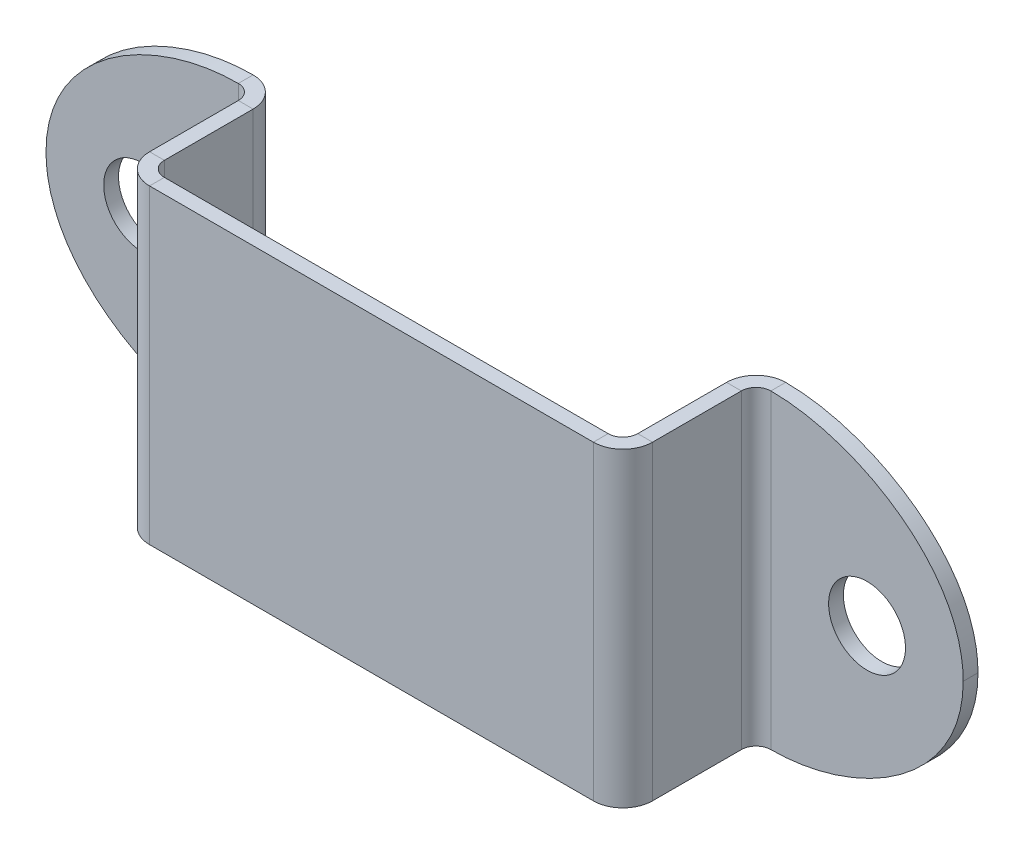
from build123d import *

# Parameters (mm, degrees)
BRIDA_BASE1_DEPTH     = 21
CROQUIS7_R            = 2.6
FORATS_CARGOLS_DEPTH  = 39.509739028
CORTAR_EXTRUIR1_DEPTH = 39.509739028


# Sheet-metal steps are written as plain solids
with BuildPart() as part:
    # Croquis1 → Brida base1 (new body)
    with BuildSketch(Plane(origin=(0, 0, 0), x_dir=(1, 0, 0), z_dir=(0, 1, 0))):
        with BuildLine():
            Line((-31, 0), (-18, 0))
            ThreePointArc((-18, 0), (-16.585786438, -0.585786438), (-16, -2))
            Line((-16, -2), (-16, -8))
            ThreePointArc((-16, -8), (-15.707106781, -8.707106781), (-15, -9))
            Line((-15, -9), (15, -9))
            ThreePointArc((15, -9), (15.707106781, -8.707106781), (16, -8))
            Line((16, -8), (16, -2))
            ThreePointArc((16, -2), (16.585786438, -0.585786438), (18, 0))
            Line((18, 0), (31, 0))
            Line((31, 0), (31, -1))
            Line((31, -1), (18, -1))
            ThreePointArc((18, -1), (17.292893219, -1.292893219), (17, -2))
            Line((17, -2), (17, -8))
            ThreePointArc((17, -8), (16.414213562, -9.414213562), (15, -10))
            Line((15, -10), (-15, -10))
            ThreePointArc((-15, -10), (-16.414213562, -9.414213562), (-17, -8))
            Line((-17, -8), (-17, -2))
            ThreePointArc((-17, -2), (-17.292893219, -1.292893219), (-18, -1))
            Line((-18, -1), (-31, -1))
            Line((-31, -1), (-31, 0))
        make_face()
    extrude(amount=BRIDA_BASE1_DEPTH)

    # Croquis7 → Forats cargols (cut, through all)
    with BuildSketch(Plane.XY.offset(1)):
        with Locations((-24.5, 10.5)):
            Circle(CROQUIS7_R)
        with Locations(Location((24.5, 10.5, 0), (0, 0, 180))):
            Circle(CROQUIS7_R)
    extrude(amount=-FORATS_CARGOLS_DEPTH, mode=Mode.SUBTRACT)

    # Croquis8 → Cortar-Extruir1 (cut, through all)
    with BuildSketch(Plane.XY.offset(1)):
        with BuildLine():
            Line((-18, 21), (-32, 21))
            Line((-32, 21), (-32, 0))
            Line((-32, 0), (-18, 0))
            add(Edge.make_bspline(
                [(-18, 0), (-23.840607907, 0), (-31, 4.168476811), (-31, 10.5)],
                knots=[0, 0, 0, 0, 1, 1, 1, 1], degree=3))
            add(Edge.make_bspline(
                [(-18, 21), (-23.840607907, 21), (-31, 16.831523189), (-31, 10.5)],
                knots=[0, 0, 0, 0, 1, 1, 1, 1], degree=3))
        make_face()
        with BuildLine():
            Line((32, 0), (18, 0))
            add(Edge.make_bspline(
                [(18, 0), (23.840607907, 0), (31, 4.168476811), (31, 10.5)],
                knots=[0, 0, 0, 0, 1, 1, 1, 1], degree=3))
            add(Edge.make_bspline(
                [(18, 21), (23.840607907, 21), (31, 16.831523189), (31, 10.5)],
                knots=[0, 0, 0, 0, 1, 1, 1, 1], degree=3))
            Line((18, 21), (32, 21))
            Line((32, 21), (32, 0))
        make_face()
    extrude(amount=-CORTAR_EXTRUIR1_DEPTH, mode=Mode.SUBTRACT)


solid = part.part
